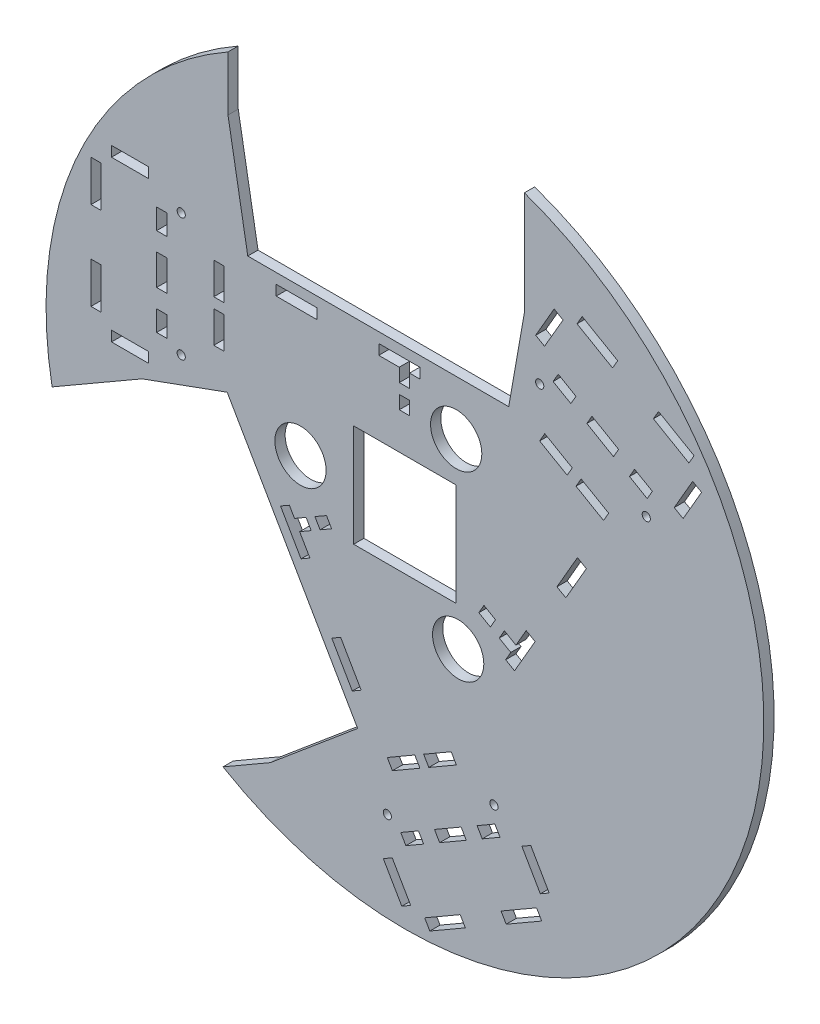
from build123d import *

# Parameters (mm, degrees)
ESQUISSE1_R                = 175
BOSS_EXTRU_1_DEPTH         = 5
ESQUISSE2_W                = 18
ESQUISSE2_H                = 5
ESQUISSE2_W_2              = 5
ESQUISSE2_H_2              = 20
ESQUISSE2_H_3              = 10
ESQUISSE2_H_4              = 15
ESQUISSE2_H_5              = 15.5
ESQUISSE2_W_3              = 20
ESQUISSE2_H_6              = 6.5
ENL_V_MAT_EXTRU_1_DEPTH    = 5
ESQUISSE6_R                = 12.5
ESQUISSE6_W                = 50
ESQUISSE6_H                = 50
ENL_V_MAT_EXTRU_6_DEPTH    = 5
TROUS_DE_CENTRAGE_4_0MM1_D = 4


with BuildPart() as part:
    # Esquisse1 → Boss.-Extru.1 (new body)
    with BuildSketch(Plane.XY):
        with Locations((148.080426897, -12.110171348)):
            Circle(ESQUISSE1_R)
    extrude(amount=BOSS_EXTRU_1_DEPTH)

    # Esquisse2 → Enlèv. mat.-Extru.1 (cut)
    with BuildSketch(Plane.XY.offset(5)):
        Polygon((135.311788567, 53.777441362), (135.311788567, 48.777441362), (145.311788567, 48.777441362), (145.311788567, 42.277441362), (150.311788567, 42.277441362), (150.311788567, 48.777441362), (155.311788567, 48.777441362), (155.311788567, 53.777441362), align=None)
        with Locations((14, 69.777441362)):
            Rectangle(ESQUISSE2_W, ESQUISSE2_H)
        with Locations((-2.5, 52.277441362)):
            Rectangle(ESQUISSE2_W_2, ESQUISSE2_H_2)
        with Locations((-2.5, 9.277441362)):
            Rectangle(ESQUISSE2_W_2, ESQUISSE2_H_2)
        with Locations((14, -8.222558638)):
            Rectangle(ESQUISSE2_W, ESQUISSE2_H)
        with Locations((29.5, 9.277441362)):
            Rectangle(ESQUISSE2_W_2, ESQUISSE2_H_3)
        with Locations((29.5, 30.777441362)):
            Rectangle(ESQUISSE2_W_2, ESQUISSE2_H_4)
        with Locations((29.5, 52.277441362)):
            Rectangle(ESQUISSE2_W_2, ESQUISSE2_H_3)
        with Locations((57.36, 41.027441362)):
            Rectangle(ESQUISSE2_W_2, ESQUISSE2_H_5)
        with Locations((57.36, 20.527441362)):
            Rectangle(ESQUISSE2_W_2, ESQUISSE2_H_5)
        with Locations((95.311788567, 51.277441362)):
            Rectangle(ESQUISSE2_W_3, ESQUISSE2_H)
        with Locations((147.811788567, 34.027441362)):
            Rectangle(ESQUISSE2_W_2, ESQUISSE2_H_6)
        Polygon((292.702456717, 69.607306773), (283.702456717, 54.018849505), (279.372329698, 56.518849505), (288.372329698, 72.107306773), align=None)
        Polygon((289.042202679, 83.267560811), (286.542202679, 78.937433792), (269.221694603, 88.937433792), (271.721694603, 93.267560811), align=None)
        Polygon((251.803110316, 104.767560811), (249.303110316, 100.437433792), (231.982602241, 110.437433792), (234.482602241, 114.767560811), align=None)
        Polygon((225.152475222, 108.607306773), (216.152475222, 93.018849505), (211.822348203, 95.518849505), (220.822348203, 111.107306773), align=None)
        Polygon((231.472983297, 79.55474789), (228.972983297, 75.224620871), (220.31272926, 80.224620871), (222.81272926, 84.55474789), align=None)
        Polygon((252.257592988, 67.55474789), (249.757592988, 63.224620871), (236.767211932, 70.724620871), (239.267211932, 75.05474789), align=None)
        Polygon((268.71207566, 58.05474789), (266.21207566, 53.724620871), (257.551821622, 58.724620871), (260.051821622, 63.05474789), align=None)
        Polygon((247.420859728, 38.17728014), (244.920859728, 33.847153121), (231.497465969, 41.597153121), (233.997465969, 45.92728014), align=None)
        Polygon((229.66733895, 48.42728014), (227.16733895, 44.097153121), (213.743945192, 51.847153121), (216.243945192, 56.17728014), align=None)
        Polygon((211.525092463, -33.996012539), (207.194965444, -31.496012539), (202.194965444, -40.156266577), (196.56580032, -36.906266577), (194.06580032, -41.236393596), (199.694965444, -44.486393596), (197.194965444, -48.816520615), (201.525092463, -51.316520615), align=None)
        Polygon((236.525092463, 9.30525765), (226.525092463, -8.015250425), (222.194965444, -5.515250425), (232.194965444, 11.80525765), align=None)
        Polygon((192.235673301, -34.406266577), (189.735673301, -38.736393596), (184.106508176, -35.486393596), (186.606508176, -31.156266577), align=None)
        Polygon((146.538823973, -178.215262181), (137.538823973, -162.626804912), (141.868950992, -160.126804912), (150.868950992, -175.715262181), align=None)
        Polygon((160.199078011, -181.875516218), (157.699078011, -177.545389199), (175.019586086, -167.545389199), (177.519586086, -171.875516218), align=None)
        Polygon((197.438170373, -160.375516218), (194.938170373, -156.045389199), (212.258678449, -146.045389199), (214.758678449, -150.375516218), align=None)
        Polygon((214.088805468, -139.215262181), (205.088805468, -123.626804912), (209.418932487, -121.126804912), (218.418932487, -136.715262181), align=None)
        Polygon((185.768297392, -130.162703297), (183.268297392, -125.832576278), (191.92855143, -120.832576278), (194.42855143, -125.162703297), align=None)
        Polygon((164.983687701, -142.162703297), (162.483687701, -137.832576278), (175.474068758, -130.332576278), (177.974068758, -134.662703297), align=None)
        Polygon((148.52920503, -151.662703297), (146.02920503, -147.332576278), (154.689459067, -142.332576278), (157.189459067, -146.662703297), align=None)
        Polygon((141.960420962, -123.285235548), (139.460420962, -118.955108529), (152.88381472, -111.205108529), (155.38381472, -115.535235548), align=None)
        Polygon((159.713941739, -113.035235548), (157.213941739, -108.705108529), (170.637335498, -100.955108529), (173.137335498, -105.285235548), align=None)
        Polygon((97.404399659, -56.111942869), (101.734526678, -53.611942869), (96.734526678, -44.951688831), (102.363691803, -41.701688831), (99.863691803, -37.371561812), (94.234526678, -40.621561812), (91.734526678, -36.291434793), (87.404399659, -38.791434793), align=None)
        Polygon((122.404399659, -99.413213058), (112.404399659, -82.092704982), (116.734526678, -79.592704982), (126.734526678, -96.913213058), align=None)
        Polygon((106.693818822, -39.201688831), (104.193818822, -34.871561812), (109.822983946, -31.621561812), (112.322983946, -35.951688831), align=None)
    extrude(amount=-ENL_V_MAT_EXTRU_1_DEPTH, mode=Mode.SUBTRACT)

    # Esquisse6 → Enlèv. mat.-Extru.6 (cut)
    with BuildSketch(Plane.XY.offset(5)):
        with Locations((173.06, 32.277441362)):
            Circle(ESQUISSE6_R)
        with Locations((174.031440566, -55.936922587)):
            Circle(ESQUISSE6_R)
        with Locations((97.149840124, -12.67103282)):
            Circle(ESQUISSE6_R)
        Polygon((206.321253746, 102.221853729), (206.321253746, 185.563712918), (61.797190042, 185.563712918), (61.797190042, 113.486217733), (71.443823398, 58.777441362), (198.660831685, 58.777441362), align=None)
        with Locations((148.080426897, -12.110171348)):
            Rectangle(ESQUISSE6_W, ESQUISSE6_H)
        Polygon((19.945575289, -18.838148298), (-52.230591968, -60.509077893), (20.031439884, -185.670588519), (82.452381756, -149.631840926), (125.008255225, -113.923223194), (61.399751081, -3.750062223), align=None)
    extrude(amount=-ENL_V_MAT_EXTRU_6_DEPTH, mode=Mode.SUBTRACT)

    # Trous de centrage Ø4.0mm1 (through all)
    with Locations(Plane(origin=(148.080426897, -12.110171348, -78), x_dir=(1, 0, 0), z_dir=(0, 0, -1))):
        with Locations((65.70121345, -88.022614393), (117.662737677, -58.022614393), (-109.080426897, -72.887612711), (-109.080426897, -12.887612711), (-8.58231078, 130.910227103), (43.379213447, 100.910227103)):
            Hole(TROUS_DE_CENTRAGE_4_0MM1_D / 2)


solid = part.part
